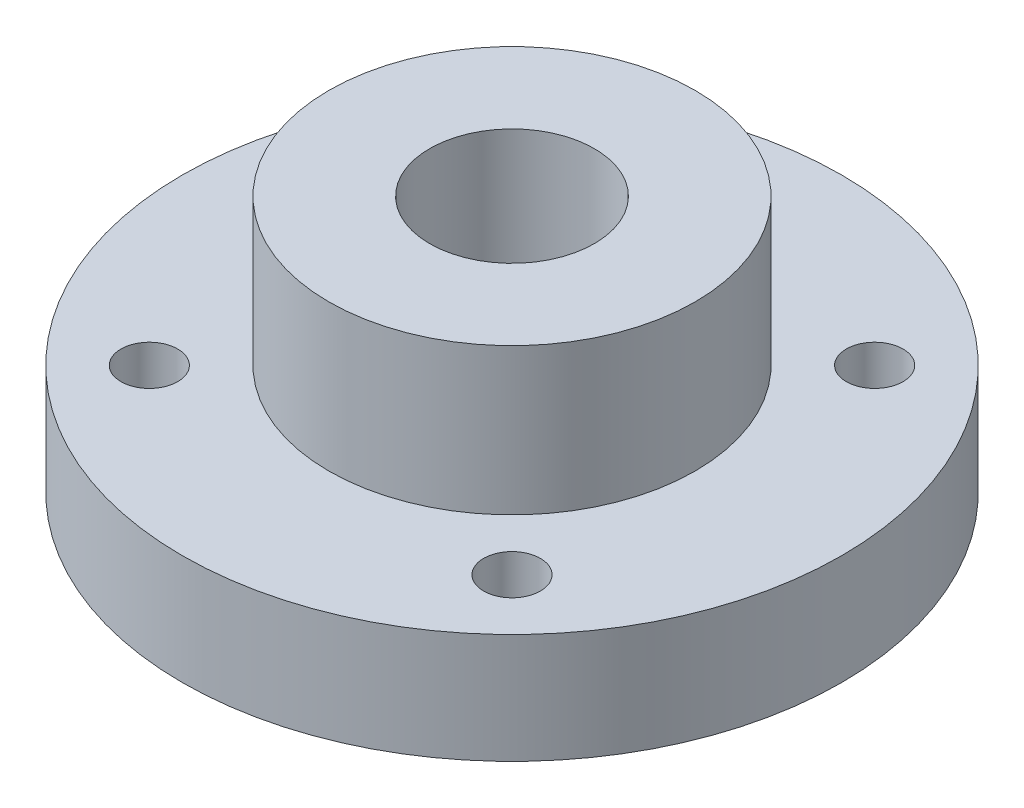
from build123d import *

# Parameters (mm, degrees)
F_10_0_1935_DIAMETER_HOLE1_D      = 4.9149
PIPE_TAP_DRILL_FOR_3_8_TAP1_D     = 14.2748
PIPE_TAP_DRILL_FOR_3_8_TAP1_DEPTH = 12.7
PIPE_TAP_DRILL_FOR_3_8_TAP1_TIP   = 4.288582582


with BuildPart() as part:
    # Sketch1 → Revolve1 (revolve)
    with BuildSketch(Plane.XY):
        Polygon((-11.1125, -70.655212574), (-11.1125, -77.005212574), (-14.2875, -77.005212574), (-14.2875, -73.830212574), (-14.2875, -70.693312574), (-19.05, -70.693312574), (-19.05, -73.830212574), (-28.575, -73.830212574), (-28.575, -64.305212574), (-15.875, -64.305212574), (-15.875, -51.605212574), (-4.7625, -51.605212574), (-4.7625, -70.655212574), align=None)
    revolve(axis=Axis((0, 0, 0), (0, -1, 0)))

    # #10 (0.1935) Diameter Hole1 (through all)
    with Locations(Plane(origin=(0, -51.605212574, 0), x_dir=(1, 0, 0), z_dir=(0, 1, 0))):
        with Locations((15.715448212, 15.715448212), (-15.715448212, 15.715448212), (-15.715448212, -15.715448212), (15.715448212, -15.715448212)):
            Hole(F_10_0_1935_DIAMETER_HOLE1_D / 2)

    # Pipe Tap Drill for 3/8 Tap1
    with Locations(Plane.ZX.offset(-51.605212574)):
        with Locations((0, 0)):
            Hole(PIPE_TAP_DRILL_FOR_3_8_TAP1_D / 2, depth=PIPE_TAP_DRILL_FOR_3_8_TAP1_DEPTH)
            with Locations((0, 0, -(PIPE_TAP_DRILL_FOR_3_8_TAP1_DEPTH + PIPE_TAP_DRILL_FOR_3_8_TAP1_TIP / 2))):  # 118° drill point
                Cone(0, PIPE_TAP_DRILL_FOR_3_8_TAP1_D / 2, PIPE_TAP_DRILL_FOR_3_8_TAP1_TIP, mode=Mode.SUBTRACT)


solid = part.part
